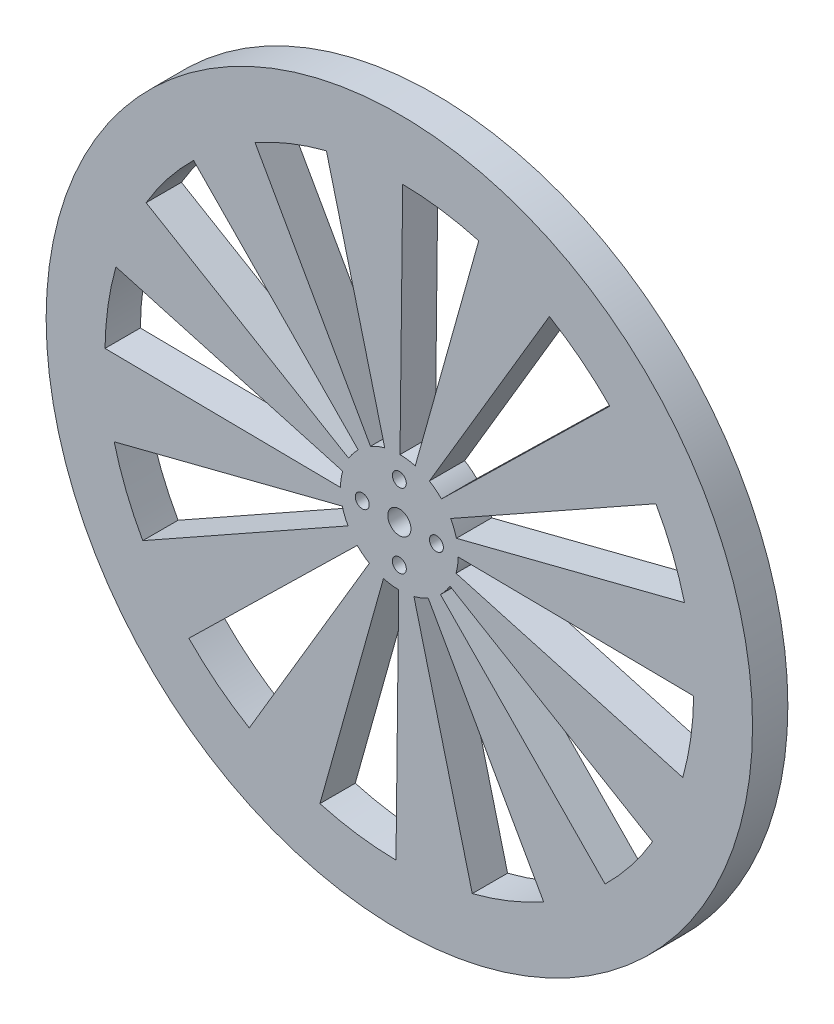
from build123d import *

# Parameters (mm, degrees)
SKETCH2_R           = 76.2
BOSS_EXTRUDE1_DEPTH = 7.62
CUT_EXTRUDE3_DEPTH  = 109.032145216
SKETCH6_R           = 1.5
CUT_EXTRUDE4_DEPTH  = 109.032145216
CIRPATTERN1_COUNT   = 4
SKETCH7_R           = 2.5
CUT_EXTRUDE5_DEPTH  = 109.032145216


with BuildPart() as part:
    # Sketch2 → Boss-Extrude1 (new body)
    with BuildSketch(Plane.XY):
        Circle(SKETCH2_R)
    extrude(amount=BOSS_EXTRUDE1_DEPTH)

    # Sketch5 → Cut-Extrude3 (cut, through all)
    with BuildSketch(Plane.XY.offset(7.62)):
        with BuildLine():
            Line((32.374162094, 54.627498832), (6.474832419, 10.925499766))
            ThreePointArc((6.474832419, 10.925499766), (7.845503213, 9.986895381), (9.081935271, 8.877412446))
            Line((9.081935271, 8.877412446), (45.409676356, 44.387062229))
            ThreePointArc((45.409676356, 44.387062229), (39.227516063, 49.934476903), (32.374162094, 54.627498832))
        make_face()
        with BuildLine():
            ThreePointArc((11.070119243, 6.224344137), (11.787852778, 4.726153498), (12.303892883, 3.147097062))
            Line((12.303892883, 3.147097062), (61.519464416, 15.735485312))
            ThreePointArc((61.519464416, 15.735485312), (58.939263889, 23.630767491), (55.350596216, 31.121720687))
            Line((55.350596216, 31.121720687), (11.070119243, 6.224344137))
        make_face()
        with BuildLine():
            ThreePointArc((12.699176556, -0.144619477), (12.571656711, -1.800957397), (12.229032333, -3.426480437))
            Line((12.229032333, -3.426480437), (61.145161667, -17.132402187))
            ThreePointArc((61.145161667, -17.132402187), (62.858283554, -9.004786986), (63.495882781, -0.723097384))
            Line((63.495882781, -0.723097384), (12.699176556, -0.144619477))
        make_face()
        with BuildLine():
            ThreePointArc((10.925499766, -6.474832419), (9.986895381, -7.845503213), (8.877412446, -9.081935271))
            Line((8.877412446, -9.081935271), (44.387062229, -45.409676356))
            ThreePointArc((44.387062229, -45.409676356), (49.934476903, -39.227516063), (54.627498832, -32.374162094))
            Line((54.627498832, -32.374162094), (10.925499766, -6.474832419))
        make_face()
        with BuildLine():
            ThreePointArc((6.224344137, -11.070119243), (4.726153498, -11.787852778), (3.147097062, -12.303892883))
            Line((3.147097062, -12.303892883), (15.735485312, -61.519464416))
            ThreePointArc((15.735485312, -61.519464416), (23.630767491, -58.939263889), (31.121720687, -55.350596216))
            Line((31.121720687, -55.350596216), (6.224344137, -11.070119243))
        make_face()
        with BuildLine():
            ThreePointArc((-0.144619477, -12.699176556), (-1.800957397, -12.571656711), (-3.426480437, -12.229032333))
            Line((-3.426480437, -12.229032333), (-17.132402187, -61.145161667))
            ThreePointArc((-17.132402187, -61.145161667), (-9.004786986, -62.858283554), (-0.723097384, -63.495882781))
            Line((-0.723097384, -63.495882781), (-0.144619477, -12.699176556))
        make_face()
        with BuildLine():
            ThreePointArc((-6.474832419, -10.925499766), (-7.845503213, -9.986895381), (-9.081935271, -8.877412446))
            Line((-9.081935271, -8.877412446), (-45.409676356, -44.387062229))
            ThreePointArc((-45.409676356, -44.387062229), (-39.227516063, -49.934476903), (-32.374162094, -54.627498832))
            Line((-32.374162094, -54.627498832), (-6.474832419, -10.925499766))
        make_face()
        with BuildLine():
            ThreePointArc((-11.070119243, -6.224344137), (-11.787852778, -4.726153498), (-12.303892883, -3.147097062))
            Line((-12.303892883, -3.147097062), (-61.519464416, -15.735485312))
            ThreePointArc((-61.519464416, -15.735485312), (-58.939263889, -23.630767491), (-55.350596216, -31.121720687))
            Line((-55.350596216, -31.121720687), (-11.070119243, -6.224344137))
        make_face()
        with BuildLine():
            ThreePointArc((-12.699176556, 0.144619477), (-12.571656711, 1.800957397), (-12.229032333, 3.426480437))
            Line((-12.229032333, 3.426480437), (-61.145161667, 17.132402187))
            ThreePointArc((-61.145161667, 17.132402187), (-62.858283554, 9.004786986), (-63.495882781, 0.723097384))
            Line((-63.495882781, 0.723097384), (-12.699176556, 0.144619477))
        make_face()
        with BuildLine():
            ThreePointArc((-10.925499766, 6.474832419), (-9.986895381, 7.845503213), (-8.877412446, 9.081935271))
            Line((-8.877412446, 9.081935271), (-44.387062229, 45.409676356))
            ThreePointArc((-44.387062229, 45.409676356), (-49.934476903, 39.227516063), (-54.627498832, 32.374162094))
            Line((-54.627498832, 32.374162094), (-10.925499766, 6.474832419))
        make_face()
        with BuildLine():
            ThreePointArc((-6.224344137, 11.070119243), (-4.726153498, 11.787852778), (-3.147097062, 12.303892883))
            Line((-3.147097062, 12.303892883), (-15.735485312, 61.519464416))
            ThreePointArc((-15.735485312, 61.519464416), (-23.630767491, 58.939263889), (-31.121720687, 55.350596216))
            Line((-31.121720687, 55.350596216), (-6.224344137, 11.070119243))
        make_face()
        with BuildLine():
            ThreePointArc((0.144619477, 12.699176556), (1.800957397, 12.571656711), (3.426480437, 12.229032333))
            Line((3.426480437, 12.229032333), (17.132402187, 61.145161667))
            ThreePointArc((17.132402187, 61.145161667), (9.004786986, 62.858283554), (0.723097384, 63.495882781))
            Line((0.723097384, 63.495882781), (0.144619477, 12.699176556))
        make_face()
    extrude(amount=-CUT_EXTRUDE3_DEPTH, mode=Mode.SUBTRACT)

    # Sketch6 → Cut-Extrude4 (cut, through all)
    with BuildSketch(Plane.XY.offset(7.62)):
        with Locations((0, 8)):
            Circle(SKETCH6_R)
    cut_extrude4 = extrude(amount=-CUT_EXTRUDE4_DEPTH, mode=Mode.SUBTRACT)

    # CirPattern1: Cut-Extrude4 ×4 about axis
    cirpattern1_axis = Axis((0, 0, 7.62), (0, 0, 1))
    for i in range(1, CIRPATTERN1_COUNT):
        add(cut_extrude4.rotate(cirpattern1_axis, i * 360 / CIRPATTERN1_COUNT), mode=Mode.SUBTRACT)

    # Sketch7 → Cut-Extrude5 (cut, through all)
    with BuildSketch(Plane.XY.offset(7.62)):
        Circle(SKETCH7_R)
    extrude(amount=-CUT_EXTRUDE5_DEPTH, mode=Mode.SUBTRACT)


solid = part.part
